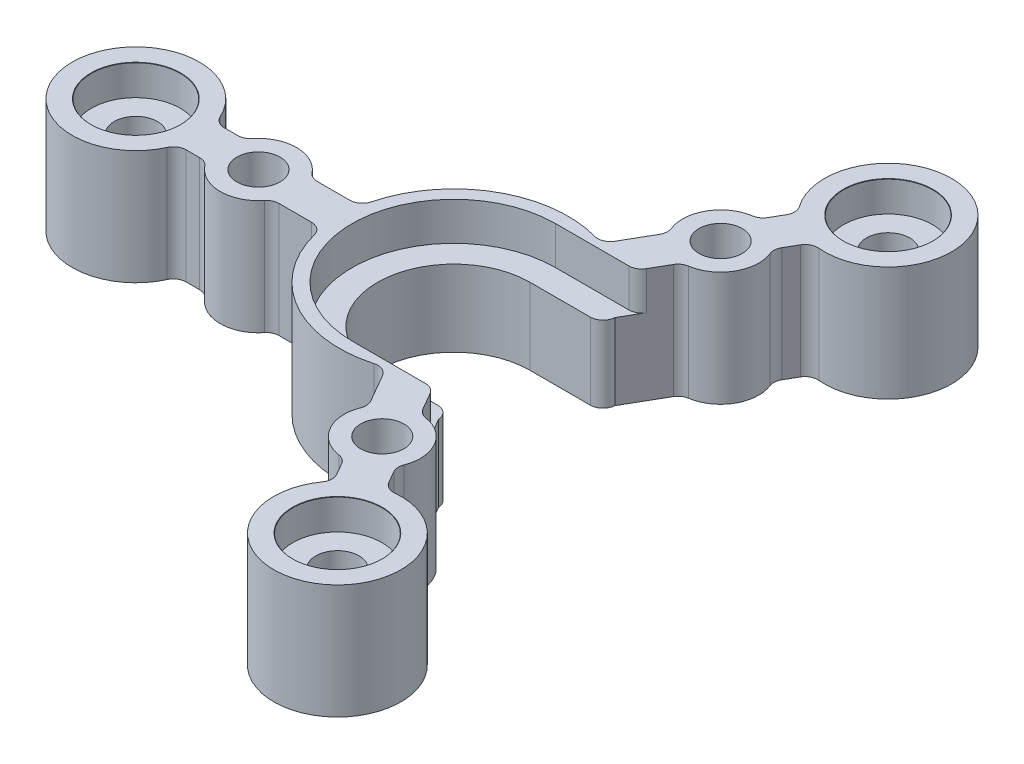
from build123d import *

# Parameters (mm, degrees)
BOSS_EXTRUDE1_DEPTH                           = 6
CUT_EXTRUDE1_START                            = -10
CUT_EXTRUDE1_DEPTH                            = 10
BOSS_EXTRUDE2_DEPTH                           = 3
FILLET1_R                                     = 1
M3_CLEARANCE_HOLE2_D                          = 3.4
CBORE_FOR_M3_PAN_HEAD_MACHINE_SCREW1_AT_COUNT = 2
CBORE_FOR_M3_PAN_HEAD_MACHINE_SCREW1_AT_PITCH = 43.301270189
CBORE_FOR_M3_PAN_HEAD_MACHINE_SCREW1_2_COUNT  = 2
CBORE_FOR_M3_PAN_HEAD_MACHINE_SCREW1_2_PITCH  = 43.301270189


with BuildPart() as part:
    # Sketch1 → Boss-Extrude1 (new body)
    with BuildSketch(Plane(origin=(0, 0, 0), x_dir=(1, 0, 0), z_dir=(0, 1, 0))):
        with BuildLine():
            Line((-5.809475019, -1.5), (-8.874119675, -1.5))
            ThreePointArc((-8.874119675, -1.5), (-4.5, -7.794228634), (3.138021732, -8.435213074))
            Line((3.138021732, -8.435213074), (1.605699404, -5.781152949))
            ThreePointArc((1.605699404, -5.781152949), (-3, -5.196152423), (-5.809475019, -1.5))
        make_face()
        with BuildLine():
            Line((-5.809475019, 1.5), (-8.874119675, 1.5))
            ThreePointArc((-8.874119675, 1.5), (-9, 0), (-8.874119675, -1.5))
            Line((-8.874119675, -1.5), (-5.809475019, -1.5))
            ThreePointArc((-5.809475019, -1.5), (-6, 0), (-5.809475019, 1.5))
        make_face()
        with BuildLine():
            Line((1.605699404, 5.781152949), (3.138021732, 8.435213074))
            ThreePointArc((3.138021732, 8.435213074), (-4.5, 7.794228634), (-8.874119675, 1.5))
            Line((-8.874119675, 1.5), (-5.809475019, 1.5))
            ThreePointArc((-5.809475019, 1.5), (-3, 5.196152423), (1.605699404, 5.781152949))
        make_face()
        with BuildLine():
            ThreePointArc((5.736097943, 6.935213074), (4.5, 7.794228634), (3.138021732, 8.435213074))
            Line((3.138021732, 8.435213074), (1.605699404, 5.781152949))
            ThreePointArc((1.605699404, 5.781152949), (3, 5.196152423), (4.203775615, 4.281152949))
            Line((4.203775615, 4.281152949), (5.736097943, 6.935213074))
        make_face()
        with BuildLine():
            ThreePointArc((9, 0), (8.143245099, 3.83243516), (5.736097943, 6.935213074))
            Line((5.736097943, 6.935213074), (4.203775615, 4.281152949))
            ThreePointArc((4.203775615, 4.281152949), (5.532750387, 2.321351579), (6, 0))
            ThreePointArc((6, 0), (5.532750387, -2.321351579), (4.203775615, -4.281152949))
            Line((4.203775615, -4.281152949), (5.736097943, -6.935213074))
            ThreePointArc((5.736097943, -6.935213074), (8.143245099, -3.83243516), (9, 0))
        make_face()
        with BuildLine():
            ThreePointArc((3.138021732, -8.435213074), (4.5, -7.794228634), (5.736097943, -6.935213074))
            Line((5.736097943, -6.935213074), (4.203775615, -4.281152949))
            ThreePointArc((4.203775615, -4.281152949), (3, -5.196152423), (1.605699404, -5.781152949))
            Line((1.605699404, -5.781152949), (3.138021732, -8.435213074))
        make_face()
        with BuildLine():
            ThreePointArc((-8.874119675, -1.5), (-9, 0), (-8.874119675, 1.5))
            Line((-8.874119675, 1.5), (-12.761923789, 1.5))
            ThreePointArc((-12.761923789, 1.5), (-12.462222521, 0.776457135), (-12.36, 0))
            ThreePointArc((-12.36, 0), (-12.462222521, -0.776457135), (-12.761923789, -1.5))
            Line((-12.761923789, -1.5), (-8.874119675, -1.5))
        make_face()
        with BuildLine():
            Line((-12.761923789, -1.5), (-12.761923789, 1.5))
            ThreePointArc((-12.761923789, 1.5), (-15.36, 3), (-17.958076211, 1.5))
            Line((-17.958076211, 1.5), (-17.958076211, -1.5))
            ThreePointArc((-17.958076211, -1.5), (-15.36, -3), (-12.761923789, -1.5))
        make_face()
        with BuildLine():
            Line((-17.958076211, -1.5), (-17.958076211, 1.5))
            ThreePointArc((-17.958076211, 1.5), (-18.36, 0), (-17.958076211, -1.5))
        make_face()
        with BuildLine():
            ThreePointArc((-17.958076211, -1.5), (-18.36, 0), (-17.958076211, 1.5))
            Line((-17.958076211, 1.5), (-20.230303993, 1.5))
            ThreePointArc((-20.230303993, 1.5), (-20.057911371, 0.758788496), (-20, 0))
            ThreePointArc((-20, 0), (-20.057911371, -0.758788496), (-20.230303993, -1.5))
            Line((-20.230303993, -1.5), (-17.958076211, -1.5))
        make_face()
        with BuildLine():
            ThreePointArc((-20, 0), (-20.057911371, 0.758788496), (-20.230303993, 1.5))
            Line((-20.230303993, 1.5), (-20.230303993, -1.5))
            ThreePointArc((-20.230303993, -1.5), (-20.057911371, -0.758788496), (-20, 0))
        make_face()
        with BuildLine():
            Line((-20.230303993, -1.5), (-20.230303993, 1.5))
            ThreePointArc((-20.230303993, 1.5), (-30, 0), (-20.230303993, -1.5))
        make_face()
        with BuildLine():
            ThreePointArc((-20, 0), (-20.057911371, 0.758788496), (-20.230303993, 1.5))
            Line((-20.230303993, 1.5), (-20.230303993, -1.5))
            ThreePointArc((-20.230303993, -1.5), (-20.057911371, -0.758788496), (-20, 0))
        make_face()
        with BuildLine():
            Line((-20.230303993, -1.5), (-20.230303993, 1.5))
            ThreePointArc((-20.230303993, 1.5), (-30, 0), (-20.230303993, -1.5))
        make_face()
        with BuildLine():
            Line((7.68, -10.302150202), (5.736097943, -6.935213074))
            ThreePointArc((5.736097943, -6.935213074), (4.5, -7.794228634), (3.138021732, -8.435213074))
            Line((3.138021732, -8.435213074), (5.081923789, -11.802150202))
            ThreePointArc((5.081923789, -11.802150202), (6.18, -10.704073991), (7.68, -10.302150202))
        make_face()
        with BuildLine():
            ThreePointArc((10.68, -13.302150202), (9.801320344, -11.180829859), (7.68, -10.302150202))
            Line((7.68, -10.302150202), (5.081923789, -11.802150202))
            ThreePointArc((5.081923789, -11.802150202), (5.081923789, -14.802150202), (7.68, -16.302150202))
            Line((7.68, -16.302150202), (10.278076211, -14.802150202))
            ThreePointArc((10.278076211, -14.802150202), (10.577777479, -14.078607337), (10.68, -13.302150202))
        make_face()
        with BuildLine():
            Line((5.081923789, -11.802150202), (7.68, -10.302150202))
            ThreePointArc((7.68, -10.302150202), (6.18, -10.704073991), (5.081923789, -11.802150202))
        make_face()
        with BuildLine():
            Line((10.278076211, -14.802150202), (7.68, -16.302150202))
            ThreePointArc((7.68, -16.302150202), (9.18, -15.900226413), (10.278076211, -14.802150202))
        make_face()
        with BuildLine():
            ThreePointArc((10.278076211, -14.802150202), (9.18, -15.900226413), (7.68, -16.302150202))
            Line((7.68, -16.302150202), (8.816113891, -18.269957184))
            ThreePointArc((8.816113891, -18.269957184), (10, -17.320508076), (11.414190102, -16.769957184))
            Line((11.414190102, -16.769957184), (10.278076211, -14.802150202))
        make_face()
        with BuildLine():
            ThreePointArc((11.414190102, -16.769957184), (10, -17.320508076), (8.816113891, -18.269957184))
            Line((8.816113891, -18.269957184), (11.414190102, -16.769957184))
        make_face()
        with BuildLine():
            Line((11.414190102, -16.769957184), (8.816113891, -18.269957184))
            ThreePointArc((8.816113891, -18.269957184), (10.686085799, -26.310003643), (17.5, -21.650635095))
            ThreePointArc((17.5, -21.650635095), (15.628174429, -17.750055042), (11.414190102, -16.769957184))
        make_face()
        with BuildLine():
            ThreePointArc((11.414190102, -16.769957184), (10, -17.320508076), (8.816113891, -18.269957184))
            Line((8.816113891, -18.269957184), (11.414190102, -16.769957184))
        make_face()
        with BuildLine():
            Line((11.414190102, -16.769957184), (8.816113891, -18.269957184))
            ThreePointArc((8.816113891, -18.269957184), (10.686085799, -26.310003643), (17.5, -21.650635095))
            ThreePointArc((17.5, -21.650635095), (15.628174429, -17.750055042), (11.414190102, -16.769957184))
        make_face()
        with BuildLine():
            ThreePointArc((-12.36, 0), (-12.462222521, 0.776457135), (-12.761923789, 1.5))
            Line((-12.761923789, 1.5), (-12.761923789, -1.5))
            ThreePointArc((-12.761923789, -1.5), (-12.462222521, -0.776457135), (-12.36, 0))
        make_face()
        with BuildLine():
            ThreePointArc((7.68, 10.302150202), (6.18, 10.704073991), (5.081923789, 11.802150202))
            Line((5.081923789, 11.802150202), (3.138021732, 8.435213074))
            ThreePointArc((3.138021732, 8.435213074), (4.5, 7.794228634), (5.736097943, 6.935213074))
            Line((5.736097943, 6.935213074), (7.68, 10.302150202))
        make_face()
        with BuildLine():
            Line((7.68, 10.302150202), (5.081923789, 11.802150202))
            ThreePointArc((5.081923789, 11.802150202), (6.18, 10.704073991), (7.68, 10.302150202))
        make_face()
        with BuildLine():
            ThreePointArc((10.68, 13.302150202), (10.577777479, 14.078607337), (10.278076211, 14.802150202))
            Line((10.278076211, 14.802150202), (7.68, 16.302150202))
            ThreePointArc((7.68, 16.302150202), (5.081923789, 14.802150202), (5.081923789, 11.802150202))
            Line((5.081923789, 11.802150202), (7.68, 10.302150202))
            ThreePointArc((7.68, 10.302150202), (9.801320344, 11.180829859), (10.68, 13.302150202))
        make_face()
        with BuildLine():
            Line((7.68, 16.302150202), (10.278076211, 14.802150202))
            ThreePointArc((10.278076211, 14.802150202), (9.18, 15.900226413), (7.68, 16.302150202))
        make_face()
        with BuildLine():
            ThreePointArc((7.68, 16.302150202), (9.18, 15.900226413), (10.278076211, 14.802150202))
            Line((10.278076211, 14.802150202), (11.414190102, 16.769957184))
            ThreePointArc((11.414190102, 16.769957184), (10, 17.320508076), (8.816113891, 18.269957184))
            Line((8.816113891, 18.269957184), (7.68, 16.302150202))
        make_face()
        with BuildLine():
            ThreePointArc((8.816113891, 18.269957184), (10, 17.320508076), (11.414190102, 16.769957184))
            Line((11.414190102, 16.769957184), (8.816113891, 18.269957184))
        make_face()
        with BuildLine():
            Line((8.816113891, 18.269957184), (11.414190102, 16.769957184))
            ThreePointArc((11.414190102, 16.769957184), (15.628174429, 17.750055042), (17.5, 21.650635095))
            ThreePointArc((17.5, 21.650635095), (10.686085799, 26.310003643), (8.816113891, 18.269957184))
        make_face()
        with BuildLine():
            ThreePointArc((8.816113891, 18.269957184), (10, 17.320508076), (11.414190102, 16.769957184))
            Line((11.414190102, 16.769957184), (8.816113891, 18.269957184))
        make_face()
        with BuildLine():
            Line((8.816113891, 18.269957184), (11.414190102, 16.769957184))
            ThreePointArc((11.414190102, 16.769957184), (15.628174429, 17.750055042), (17.5, 21.650635095))
            ThreePointArc((17.5, 21.650635095), (10.686085799, 26.310003643), (8.816113891, 18.269957184))
        make_face()
    extrude(amount=BOSS_EXTRUDE1_DEPTH)

    # Sketch2 → Cut-Extrude1 (cut)
    with BuildSketch(Plane(origin=(0, 6, 0), x_dir=(1, 0, 0), z_dir=(0, 1, 0)).offset(CUT_EXTRUDE1_START)):
        with BuildLine():
            Line((6.708203932, 6), (0, 6))
            ThreePointArc((0, 6), (4.242640687, 4.242640687), (6, 0))
            ThreePointArc((6, 0), (4.242640687, -4.242640687), (0, -6))
            Line((0, -6), (6.708203932, -6))
            ThreePointArc((6.708203932, -6), (8.407551231, -3.211398808), (9, 0))
            ThreePointArc((9, 0), (8.407551231, 3.211398808), (6.708203932, 6))
        make_face()
    extrude(amount=CUT_EXTRUDE1_DEPTH, mode=Mode.SUBTRACT)

    # Sketch3 → Boss-Extrude2 (add)
    with BuildSketch(Plane(origin=(0, 6, 0), x_dir=(1, 0, 0), z_dir=(0, 1, 0))):
        with BuildLine():
            ThreePointArc((0, -8), (-8, 0), (0, 8))
            Line((0, 8), (6.350852961, 8))
            Line((6.350852961, 8), (7.68, 10.302150202))
            ThreePointArc((7.68, 10.302150202), (10.278076211, 11.802150202), (10.278076211, 14.802150202))
            Line((10.278076211, 14.802150202), (11.414190102, 16.769957184))
            ThreePointArc((11.414190102, 16.769957184), (15, 25.980762114), (8.816113891, 18.269957184))
            Line((8.816113891, 18.269957184), (7.68, 16.302150202))
            ThreePointArc((7.68, 16.302150202), (5.081923789, 14.802150202), (5.081923789, 11.802150202))
            Line((5.081923789, 11.802150202), (3.138021732, 8.435213074))
            ThreePointArc((3.138021732, 8.435213074), (-4.5, 7.794228634), (-8.874119675, 1.5))
            Line((-8.874119675, 1.5), (-12.761923789, 1.5))
            ThreePointArc((-12.761923789, 1.5), (-15.36, 3), (-17.958076211, 1.5))
            Line((-17.958076211, 1.5), (-20.230303993, 1.5))
            ThreePointArc((-20.230303993, 1.5), (-30, 0), (-20.230303993, -1.5))
            Line((-20.230303993, -1.5), (-17.958076211, -1.5))
            ThreePointArc((-17.958076211, -1.5), (-15.36, -3), (-12.761923789, -1.5))
            Line((-12.761923789, -1.5), (-8.874119675, -1.5))
            ThreePointArc((-8.874119675, -1.5), (-4.5, -7.794228634), (3.138021732, -8.435213074))
            Line((3.138021732, -8.435213074), (5.081923789, -11.802150202))
            ThreePointArc((5.081923789, -11.802150202), (5.081923789, -14.802150202), (7.68, -16.302150202))
            Line((7.68, -16.302150202), (8.816113891, -18.269957184))
            ThreePointArc((8.816113891, -18.269957184), (15, -25.980762114), (11.414190102, -16.769957184))
            Line((11.414190102, -16.769957184), (10.278076211, -14.802150202))
            ThreePointArc((10.278076211, -14.802150202), (10.278076211, -11.802150202), (7.68, -10.302150202))
            Line((7.68, -10.302150202), (6.350852961, -8))
            Line((6.350852961, -8), (0, -8))
        make_face()
    extrude(amount=BOSS_EXTRUDE2_DEPTH)

    # Fillet1
    # the kernel refuses this fillet: 1 mm, written as the material it adds along each edge
    with BuildSketch(Plane(origin=(-17.958076211, 9, 1.5), x_dir=(-1, 0, 0), z_dir=(0, -1, 0)), Plane(origin=(7.68, 9, -16.302150202), x_dir=(0.5000000000000027, 0, -0.866025403784437), z_dir=(0, -1, 0)), Plane(origin=(7.68, 9, -10.302150202), x_dir=(-0.4999999999999965, 0, 0.8660254037844406), z_dir=(0, -1, 0)), Plane(origin=(7.68, 0, 10.302150202), x_dir=(-0.5000000000000009, 0, -0.8660254037844382), z_dir=(0, 1, 0)), Plane(origin=(10.278076211, 9, 14.802150202), x_dir=(0.5000000000000011, 0, 0.8660254037844378), z_dir=(0, -1, 0)), Plane(origin=(5.081923789, 9, 11.802150202), x_dir=(-0.4999999999999978, 0, -0.8660254037844398), z_dir=(0, -1, 0))) as fillet1_piece_1:
        with BuildLine():
            CenterArc((0.524422788, -1), FILLET1_R, 90, 51.317812547)
            ThreePointArc((-0.256201962, -0.375), (-0.120994483, -0.192355197), (0, 0))
            Line((0, 0), (0.524422788, 0))
        make_face()
    extrude(amount=9)
    with BuildSketch(Plane(origin=(-20.230303993, 9, 1.5), x_dir=(-0.3590352743160652, 0, 0.9333239907967585), z_dir=(0, -1, 0)), Plane(origin=(8.816113891, 9, -18.269957184), x_dir=(-0.6287646488334481, 0, -0.7775956638107949), z_dir=(0, -1, 0))) as fillet1_piece_2:
        with BuildLine():
            CenterArc((0.687506882, -0.998044925), FILLET1_R, 93.583357614, 65.375681648)
            Line((-0.245817109, -0.63900965), (0, 0))
            ThreePointArc((0, 0), (0.312503128, -0.009775376), (0.625006256, 0))
        make_face()
    extrude(amount=9)
    with BuildSketch(Plane(origin=(-20.230303993, 9, -1.5), x_dir=(1, 0, 0), z_dir=(0, -1, 0)), Plane(origin=(11.414190102, 9, -16.769957184), x_dir=(-0.49999999999999795, 0, 0.8660254037844398), z_dir=(0, -1, 0))) as fillet1_piece_3:
        with BuildLine():
            CenterArc((0.68466005, -1), FILLET1_R, 90, 65.375681648)
            ThreePointArc((-0.224399293, -0.583333333), (-0.103076053, -0.295176372), (0, 0))
            Line((0, 0), (0.68466005, 0))
        make_face()
    extrude(amount=9)
    with BuildSketch(Plane(origin=(-17.958076211, 9, -1.5), x_dir=(0.5641183988536709, 0, -0.8256939094330118), z_dir=(0, -1, 0)), Plane(origin=(-12.761923789, 0, -1.5), x_dir=(-0.5641183988536762, 0, -0.8256939094330082), z_dir=(0, 1, 0)), Plane(origin=(5.081923789, 9, -11.802150202), x_dir=(-0.4330127018922323, 0, -0.9013878188659912), z_dir=(0, -1, 0)), Plane(origin=(10.278076211, 9, -14.802150202), x_dir=(0.4330127018922199, 0, 0.901387818865997), z_dir=(0, -1, 0)), Plane(origin=(7.68, 9, 16.302150202), x_dir=(-0.9971311007459096, 0, -0.07569390943299635), z_dir=(0, -1, 0)), Plane(origin=(-12.761923789, 9, 1.5), x_dir=(-0.564118398853686, 0, 0.8256939094330015), z_dir=(0, -1, 0))) as fillet1_piece_4:
        with BuildLine():
            CenterArc((0.529857366, -0.997131101), FILLET1_R, 94.341093727, 51.317812547)
            Line((-0.295836543, -0.433012702), (0, 0))
            ThreePointArc((0, 0), (0.227081728, -0.008606698), (0.454163457, 0))
        make_face()
    extrude(amount=9)
    with BuildSketch(Plane(origin=(-8.874119675, 0, -1.5), x_dir=(0.20852265690357363, 0, -0.9780175364265584), z_dir=(0, 1, 0))) as fillet1_piece_5:
        with BuildLine():
            CenterArc((0.809460605, 0.999092072), FILLET1_R, 192.035790206, 75.522487814)
            Line((-0.168556931, 0.790569415), (0, 0))
            ThreePointArc((0, 0), (0.383428708, 0.008171352), (0.766857415, 0))
        make_face()
    extrude(amount=6)
    with BuildSketch(Plane(origin=(3.138021732, 0, -8.435213074), x_dir=(-0.9512493603438537, 0, -0.3084228500701743), z_dir=(0, 1, 0))) as fillet1_piece_6:
        with BuildLine():
            CenterArc((0.809460605, -0.999092072), FILLET1_R, 92.44172198, 75.522487814)
            Line((-0.168556931, -0.790569415), (0, 0))
            ThreePointArc((0, 0), (0.383428708, -0.008171352), (0.766857415, 0))
        make_face()
    extrude(amount=6)
    with BuildSketch(Plane(origin=(11.414190102, 0, 16.769957184), x_dir=(0.9877999231494978, 0, -0.15572832698595993), z_dir=(0, 1, 0))) as fillet1_piece_7:
        with BuildLine():
            CenterArc((0.687506882, 0.998044925), FILLET1_R, 201.040960738, 65.375681648)
            Line((-0.245817109, 0.63900965), (0, 0))
            ThreePointArc((0, 0), (0.312503128, 0.009775376), (0.625006256, 0))
        make_face()
    extrude(amount=6)
    with BuildSketch(Plane(origin=(8.816113891, 0, 18.269957184), x_dir=(-0.5000000000000001, 0, -0.8660254037844385), z_dir=(0, 1, 0))) as fillet1_piece_8:
        with BuildLine():
            CenterArc((0.68466005, 1), FILLET1_R, 204.624318352, 65.375681648)
            ThreePointArc((-0.224399293, 0.583333333), (-0.103076053, 0.295176372), (0, 0))
            Line((0, 0), (0.68466005, 0))
        make_face()
    extrude(amount=9)
    with BuildSketch(Plane(origin=(3.138021732, 9, 8.435213074), x_dir=(-0.9512493603438466, -1.3775500415435472e-14, 0.3084228500701963), z_dir=(0, -1, 0))) as fillet1_piece_9:
        with BuildLine():
            CenterArc((0.809460605, -0.999092072), FILLET1_R, 92.44172198, 75.522487814)
            Line((-0.168556931, -0.790569415), (0, 0))
            ThreePointArc((0, 0), (0.383428708, -0.008171352), (0.766857415, 0))
        make_face()
    extrude(amount=9)
    with BuildSketch(Plane(origin=(-8.874119675, 9, 1.5), x_dir=(-1, 0, 0), z_dir=(0, -1, 0))) as fillet1_piece_10:
        with BuildLine():
            CenterArc((0.808338691, -1), FILLET1_R, 90, 75.522487814)
            ThreePointArc((-0.159907146, -0.75), (-0.071961847, -0.376703912), (0, 0))
            Line((0, 0), (0.808338691, 0))
        make_face()
    extrude(amount=9)
    with BuildSketch(Plane(origin=(11.414190102, 6, 16.769957184), x_dir=(0.987799923149496, 0, -0.15572832698597144), z_dir=(0, 1, 0))) as fillet1_piece_11:
        with BuildLine():
            CenterArc((0.687506882, 0.998044925), FILLET1_R, 201.040960738, 65.375681648)
            Line((-0.245817109, 0.63900965), (0, 0))
            ThreePointArc((0, 0), (0.312503128, 0.009775376), (0.625006256, 0))
        make_face()
    extrude(amount=3)
    with BuildSketch(Plane(origin=(3.138021732, 6, -8.435213074), x_dir=(-0.9512493603438414, 0, -0.3084228500702117), z_dir=(0, 1, 0))) as fillet1_piece_12:
        with BuildLine():
            CenterArc((0.809460605, -0.999092072), FILLET1_R, 92.44172198, 75.522487814)
            Line((-0.168556931, -0.790569415), (0, 0))
            ThreePointArc((0, 0), (0.383428708, -0.008171352), (0.766857415, 0))
        make_face()
    extrude(amount=3)
    with BuildSketch(Plane(origin=(-8.874119675, 6, -1.5), x_dir=(-1, 0, 0), z_dir=(0, 1, 0))) as fillet1_piece_13:
        with BuildLine():
            CenterArc((0.808338691, -1), FILLET1_R, 90, 75.522487814)
            ThreePointArc((-0.159907146, -0.75), (-0.071961847, -0.376703912), (0, 0))
            Line((0, 0), (0.808338691, 0))
        make_face()
    extrude(amount=3)
    # the kernel refuses this fillet: 1 mm, written as the material it takes off along each edge
    with BuildSketch(Plane(origin=(6.350852961, 6, -8), x_dir=(-1, 0, 0), z_dir=(0, 1, 0)), Plane(origin=(6.350852961, 6, 8), x_dir=(0.5000000000000003, 0, 0.8660254037844385), z_dir=(0, 1, 0))) as fillet1_2_piece_1:
        with BuildLine():
            CenterArc((FILLET1_R * 0.57735026919, -FILLET1_R), FILLET1_R, 90, 60)
            Line((-FILLET1_R * 0.288675134595, -FILLET1_R * 0.5), (0, 0))
            Line((0, 0), (FILLET1_R * 0.57735026919, 0))
        make_face()
    extrude(amount=4.443375673, mode=Mode.SUBTRACT)
    with BuildSketch(Plane(origin=(6.708203932, -4.925012774, -6), x_dir=(-0.720649414209032, 0, -0.6932996623395826), z_dir=(0, 1, 0))) as fillet1_2_piece_2:
        with BuildLine():
            CenterArc((2.112982691, 0.645154463), FILLET1_R, 133.891876666, 86.285380912)
            Line((1.419683028, 1.365803877), (0, 0))
            ThreePointArc((0, 0), (0.67446526, -0.025307993), (1.348930521, 0))
        make_face()
    extrude(amount=15.850025549, mode=Mode.SUBTRACT)
    with BuildSketch(Plane(origin=(6.708203932, -4.925012774, 6), x_dir=(-1, 0, 0), z_dir=(0, 1, 0))) as fillet1_2_piece_3:
        with BuildLine():
            CenterArc((1.97000511, 1), FILLET1_R, 183.714619088, 86.285380912)
            ThreePointArc((0.972105989, 0.935213074), (0.468506971, 0.485844728), (0, 0))
            Line((0, 0), (1.97000511, 0))
        make_face()
    extrude(amount=15.850025549, mode=Mode.SUBTRACT)

    # M3 Clearance Hole2 (through all)
    with Locations(Plane(origin=(0, 9, 0), x_dir=(1, 0, 0), z_dir=(0, 1, 0))):
        with Locations((7.68, 13.302150202), (7.68, -13.302150202), (-15.36, 0)):
            Hole(M3_CLEARANCE_HOLE2_D / 2)

    # Sketch8 → CBORE for M3 Pan Head Machine Screw1 (revolve, cut)
    with BuildSketch(Plane(origin=(12.5, 9, -21.650635095), x_dir=(0, 0, 1), z_dir=(1, 0, 0))):
        Polygon((0, 0), (0, 9), (1.7, 9), (1.7, 2.4), (3.5, 2.4), (3.5, 0.025), (3.525, 0), align=None)
    cbore_for_m3_pan_head_machine_screw1 = revolve(axis=Axis((12.5, 15.35, -21.650635095), (0, -1, 0)), mode=Mode.SUBTRACT)

    # CBORE for M3 Pan Head Machine Screw1 at: CBORE for M3 Pan Head Machine Screw1 ×2
    with Locations(*[(0, 0, i * CBORE_FOR_M3_PAN_HEAD_MACHINE_SCREW1_AT_PITCH) for i in range(1, CBORE_FOR_M3_PAN_HEAD_MACHINE_SCREW1_AT_COUNT)]):
        add(cbore_for_m3_pan_head_machine_screw1, mode=Mode.SUBTRACT)

    # CBORE for M3 Pan Head Machine Screw1 2: CBORE for M3 Pan Head Machine Screw1 ×2
    with Locations(*[Vector(-0.8660254037844387, 0, 0.5000000000000001) * (i * CBORE_FOR_M3_PAN_HEAD_MACHINE_SCREW1_2_PITCH) for i in range(1, CBORE_FOR_M3_PAN_HEAD_MACHINE_SCREW1_2_COUNT)]):
        add(cbore_for_m3_pan_head_machine_screw1, mode=Mode.SUBTRACT)


solid = part.part
